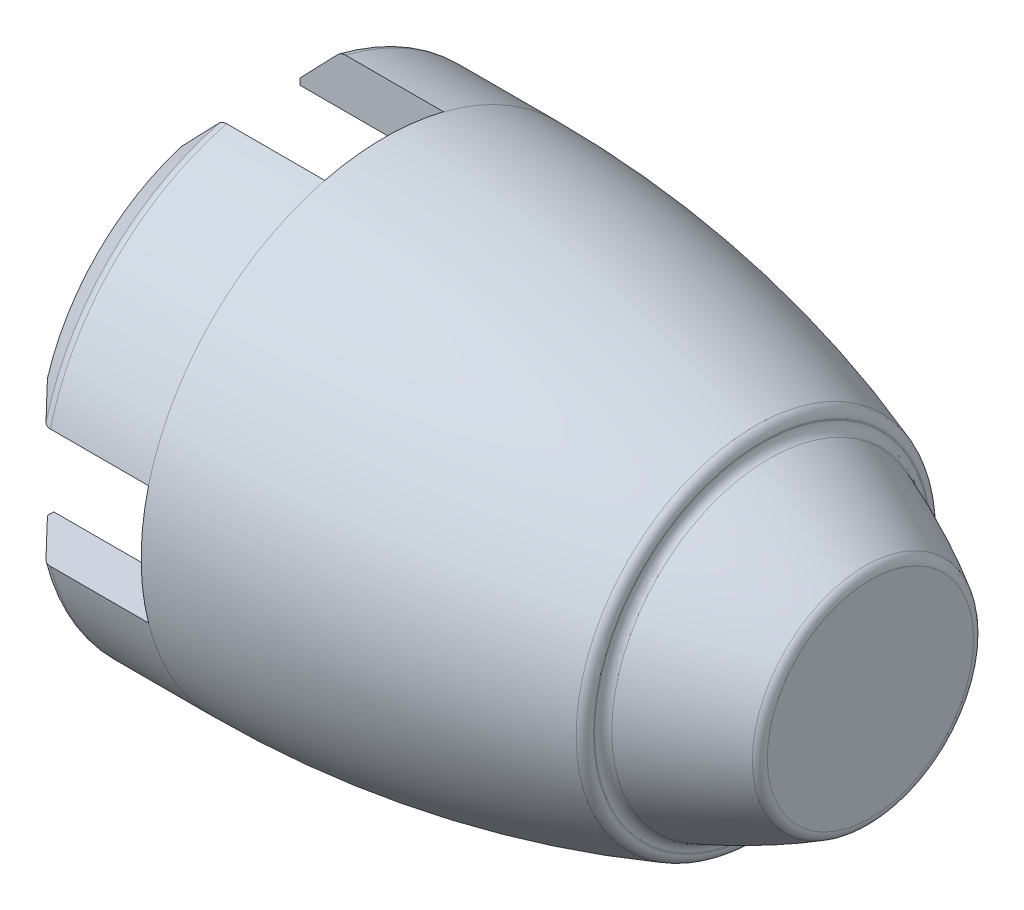
from build123d import *
from OCP.BRepFilletAPI import BRepFilletAPI_MakeChamfer

# Parameters (mm, degrees)
FILLET1_R          = 0.508
CHAMFER1_SIZE      = 2.794
FILLET2_R          = 0.508
CUT_EXTRUDE1_START = -7.62
SKETCH2_W          = 11.43
SKETCH2_H          = 5.588
CUT_EXTRUDE1_DEPTH = 7.035802
CIRPATTERN1_COUNT  = 4
SKETCH3_R          = 1.016
CUT_EXTRUDE3_DEPTH = 29.560366015
FILLET3_R          = 2.54
CHAMFER3_SIZE      = 0.4
CHAMFER3_SIZE2     = 0.282842712


with BuildPart() as part:
    # Sketch1 → Revolve1 (revolve)
    with BuildSketch(Plane.XY, mode=Mode.PRIVATE) as revolve1_sk:
        with BuildLine():
            Line((0, 9.2202), (0, 11.43))
            Line((0, 11.43), (7.62, 11.43))
            ThreePointArc((7.62, 11.43), (16.64714258, 10.64022736), (25.4, 8.294906283))
            Line((25.4, 8.294906283), (25.4, 7.532906283))
            ThreePointArc((25.4, 7.532906283), (27.994148861, 6.453326389), (30.48, 5.1435))
            Line((30.48, 5.1435), (30.48, 0))
            Line((30.48, 0), (24.13, 0))
            Line((24.13, 0), (24.13, 6.858))
            Line((24.13, 6.858), (9.398, 6.858))
            Line((9.398, 6.858), (9.398, 9.2202))
            Line((9.398, 9.2202), (0, 9.2202))
        make_face()
    revolve(revolve1_sk.sketch.rotate(Axis((24.13, 0, 0), (1, 0, 0)), 90), axis=Axis((24.13, 0, 0), (1, 0, 0)))

    # Fillet1
    fillet1_edges = [part.edges().sort_by_distance(p)[0] for p in [
        (25.4, 0, -8.294906283),
        (30.48, 0, -5.1435),
        (25.4, 0, -7.532906283),
    ]]
    fillet(fillet1_edges, radius=FILLET1_R)

    # Chamfer1
    # the kernel refuses this chamfer: 2.794 mm, written as the material it takes off along each edge
    with BuildSketch(Plane(origin=(0, 0, 0), x_dir=(0, 0, 1), z_dir=(0, 1, 0))) as chamfer1_piece_1:
        Polygon((11.43, CHAMFER1_SIZE), (11.43 - CHAMFER1_SIZE, 0), (11.43, 0), align=None)
    revolve(axis=Axis((0, 0, 0), (1, 0, 0)), mode=Mode.SUBTRACT)

    # Fillet2
    fillet2_edges = [part.edges().sort_by_distance(p)[0] for p in [
        (2.794, 0, -11.43),
    ]]
    fillet(fillet2_edges, radius=FILLET2_R)

    # Sketch2 → Cut-Extrude1 (cut)
    with BuildSketch(Plane.ZY.offset(CUT_EXTRUDE1_START)):
        with Locations((5.715, 0)):
            Rectangle(SKETCH2_W, SKETCH2_H)
    cut_extrude1 = extrude(amount=CUT_EXTRUDE1_DEPTH, mode=Mode.SUBTRACT)

    # CirPattern1: Cut-Extrude1 ×4 about axis
    cirpattern1_axis = Axis((0, 0, 0), (1, 0, 0))
    for i in range(1, CIRPATTERN1_COUNT):
        add(cut_extrude1.rotate(cirpattern1_axis, i * 360 / CIRPATTERN1_COUNT), mode=Mode.SUBTRACT)

    # Sketch3 → Cut-Extrude3 (cut, through all)
    with BuildSketch(Plane.ZY.offset(-24.13)):
        with Locations((7.62, 0)):
            Circle(SKETCH3_R)
    extrude(amount=CUT_EXTRUDE3_DEPTH, mode=Mode.SUBTRACT)

    # Fillet3
    fillet3_edges = [part.edges().sort_by_distance(p)[0] for p in [
        (16.764, -0.636845873, 6.828366667),
        (16.764, 0.636845873, 6.828366667),
    ]]
    fillet(fillet3_edges, radius=FILLET3_R)

    # Chamfer3: one chamfer whose edges measure the first distance from different faces: ONE call of the kernel's chamfer builder (chamfer() names one face for all edges)
    chamfer3_edges_1 = [part.edges().sort_by_distance(p)[0] for p in [
        (0.5842, -6.519665944, -6.519665944),
    ]]
    chamfer3_side_1 = [part.faces().sort_by_distance(p)[0] for p in [
        (1.614705122, -7.248343055, -7.248343153),
    ]]
    chamfer3_edges_2 = [part.edges().sort_by_distance(p)[0] for p in [
        (0.5842, 6.519665944, -6.519665944),
    ]]
    chamfer3_side_2 = [part.faces().sort_by_distance(p)[0] for p in [
        (1.614705122, 7.248343055, -7.248343153),
    ]]
    chamfer3_edges_3 = [part.edges().sort_by_distance(p)[0] for p in [
        (0.5842, 6.519665944, 6.519665944),
    ]]
    chamfer3_side_3 = [part.faces().sort_by_distance(p)[0] for p in [
        (1.614705122, 7.248342472, 7.248343736),
    ]]
    chamfer3_edges_4 = [part.edges().sort_by_distance(p)[0] for p in [
        (0.5842, -6.519665944, 6.519665944),
    ]]
    chamfer3_side_4 = [part.faces().sort_by_distance(p)[0] for p in [
        (1.614705122, -7.248342472, 7.248343736),
    ]]
    chamfer3 = BRepFilletAPI_MakeChamfer(part.part.solid().wrapped)
    for e in chamfer3_edges_1:
        chamfer3.Add(CHAMFER3_SIZE, CHAMFER3_SIZE2, e.wrapped, chamfer3_side_1[0].wrapped)  # the first distance lies on this face
    for e in chamfer3_edges_2:
        chamfer3.Add(CHAMFER3_SIZE, CHAMFER3_SIZE2, e.wrapped, chamfer3_side_2[0].wrapped)  # the first distance lies on this face
    for e in chamfer3_edges_3:
        chamfer3.Add(CHAMFER3_SIZE, CHAMFER3_SIZE2, e.wrapped, chamfer3_side_3[0].wrapped)  # the first distance lies on this face
    for e in chamfer3_edges_4:
        chamfer3.Add(CHAMFER3_SIZE, CHAMFER3_SIZE2, e.wrapped, chamfer3_side_4[0].wrapped)  # the first distance lies on this face
    add(Compound.cast(chamfer3.Shape()), mode=Mode.REPLACE)


solid = part.part
